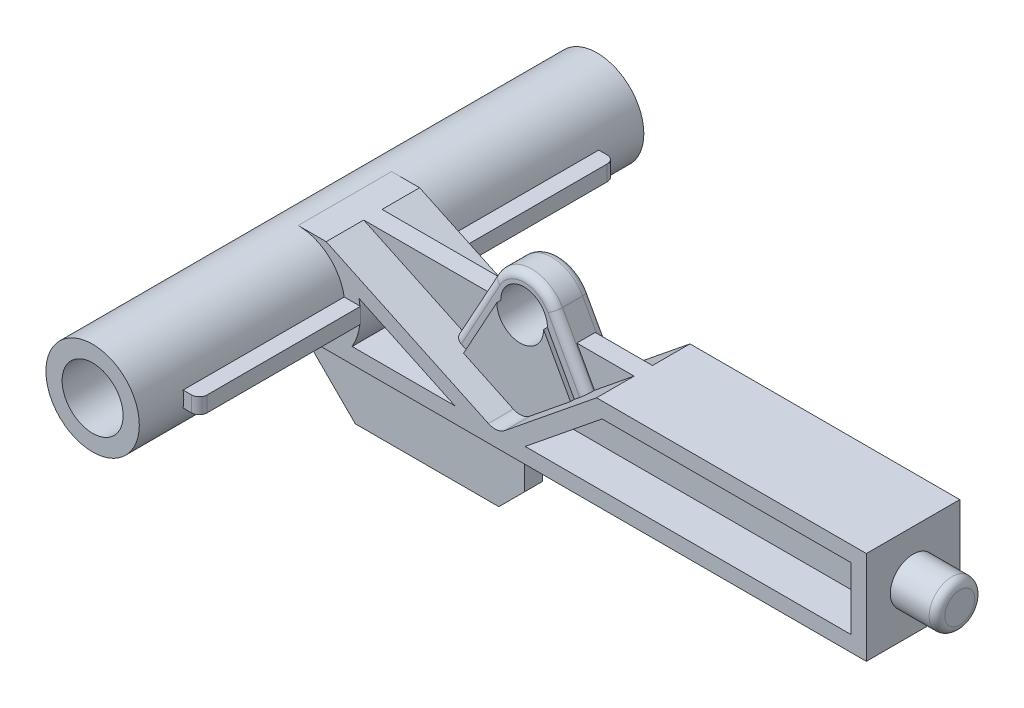
from build123d import *

# Parameters (mm, degrees)
BOSS_EXTRUDE3_DEPTH  = 3
SKETCH2_R            = 2.9999999999999982
BOSS_EXTRUDE4_DEPTH  = 16.205
SKETCH5_R            = 1.96
CUT_EXTRUDE2_DEPTH   = 32.80000000000002
SKETCH6_R            = 1.465
BOSS_EXTRUDE7_DEPTH  = 3
FILLET1_R            = 0.5
BOSS_EXTRUDE8_DEPTH  = 0.59
BOSS_EXTRUDE9_DEPTH  = 13.35
FILLET7_R            = 0.5
FILLET8_R            = 0.5
BOSS_EXTRUDE10_DEPTH = 3
CUT_EXTRUDE4_DEPTH   = 3
BOSS_EXTRUDE11_DEPTH = 0.59
BOSS_EXTRUDE12_DEPTH = 1.395
CUT_EXTRUDE6_DEPTH   = 20.895000000000014
CUT_EXTRUDE7_DEPTH   = 0.25
CUT_EXTRUDE8_DEPTH   = 0.25
FILLET9_R            = 0.5
FILLET10_R           = 0.5
CUT_EXTRUDE9_DEPTH   = 2.5
CUT_EXTRUDE10_DEPTH  = 2.5
CUT_EXTRUDE12_DEPTH  = 2.5
CUT_EXTRUDE14_START  = -2.5
CUT_EXTRUDE14_DEPTH  = 2.5


with BuildPart() as part:
    # Sketch1 → Boss-Extrude3 (new, symmetric)
    with BuildSketch(Plane.XY):
        with BuildLine():
            ThreePointArc((2.9999999999999982, 2.9999999999999973), (2.1213203435596406, 0.8786796564403563), (-5.5e-16, 0))
            Line((0, 0), (36.5, 0))
            Line((36.5, 0), (36.5, 6))
            Line((36.5, 6), (20.749999999999996, 5.999999999999999))
            ThreePointArc((20.749999999999996, 5.999999999999999), (20.435386233554034, 4.445031090493969), (19.54103584523481, 3.134669493650969))
            ThreePointArc((19.54103584523481, 3.1346694936509705), (17.593985916344508, 2.2872332130112563), (15.573673818645423, 2.9410609450836516))
            Line((15.573673818645423, 2.9410609450836516), (11.749999999999998, 5.9999999999999964))
            Line((11.749999999999998, 5.9999999999999964), (0, 5.9999999999999964))
            ThreePointArc((1.8e-16, 5.9999999999999964), (2.1213203435596415, 5.121320343559639), (2.9999999999999982, 2.9999999999999982))
        make_face()
    extrude(amount=BOSS_EXTRUDE3_DEPTH, both=True)

    # Sketch2 → Boss-Extrude4 (add, symmetric)
    with BuildSketch(Plane.XY):
        with Locations((0, 2.9999999999999982)):
            Circle(SKETCH2_R)
    extrude(amount=BOSS_EXTRUDE4_DEPTH, both=True)

    # Sketch5 → Cut-Extrude2 (cut)
    with BuildSketch(Plane.XY.offset(16.205)):
        with Locations((0, 2.9999999999999982)):
            Circle(SKETCH5_R)
    extrude(amount=-CUT_EXTRUDE2_DEPTH, mode=Mode.SUBTRACT)

    # Sketch6 → Boss-Extrude7 (add)
    with BuildSketch(Plane(origin=(36.5, 0, 0), x_dir=(0, 0, -1), z_dir=(1, 0, 0))):
        with Locations((0, 2.999999999999999)):
            Circle(SKETCH6_R)
    extrude(amount=BOSS_EXTRUDE7_DEPTH)

    # Fillet1
    fillet1_edges = [part.edges().sort_by_distance(p)[0] for p in [
        (39.5, 2.9999999999999987, 1.465),
    ]]
    fillet(fillet1_edges, radius=FILLET1_R)

    # Sketch12 → Boss-Extrude8 (add, symmetric)
    with BuildSketch(Plane.XY):
        with BuildLine():
            Line((12.12, -2.99e-15), (12.12, -3.970000000000003))
            Line((12.12, -3.970000000000003), (10.479512267647207, -5.6104877323527935))
            Line((10.479512267647207, -5.6104877323527935), (1.2595122676472073, -5.610487732352795))
            Line((1.2595122676472073, -5.610487732352795), (-2.8063517241754403, -1.5446237405301462))
            Line((-2.8063517241754403, -1.5446237405301462), (-2.8063517241754403, 1.939627423865778))
            ThreePointArc((-2.8063517241754403, 1.939627423865778), (-1.7057083970593148, 0.5320942351456543), (0, 0))
            Line((0, 0), (12.12, -2.99e-15))
        make_face()
    extrude(amount=BOSS_EXTRUDE8_DEPTH, both=True)

    # Sketch14 → Boss-Extrude9 (add, symmetric)
    with BuildSketch(Plane.XY):
        with BuildLine():
            Line((3.9999999999999982, 2.4999999999999982), (3.9999999999999982, 3.4999999999999982))
            Line((3.9999999999999982, 3.4999999999999982), (2.9580398915498067, 3.4999999999999982))
            ThreePointArc((2.9580398915498067, 3.4999999999999982), (2.999999999999999, 2.9999999999999982), (2.9580398915498067, 2.4999999999999982))
            Line((2.9580398915498067, 2.4999999999999982), (3.9999999999999982, 2.4999999999999982))
        make_face()
    extrude(amount=BOSS_EXTRUDE9_DEPTH, both=True)

    # Fillet7
    fillet7_edges = [part.edges().sort_by_distance(p)[0] for p in [
        (3.9999999999999982, 2.9999999999999982, 13.35),
    ]]
    fillet(fillet7_edges, radius=FILLET7_R)

    # Fillet8
    fillet8_edges = [part.edges().sort_by_distance(p)[0] for p in [
        (3.9999999999999982, 2.9999999999999982, -13.35),
    ]]
    fillet(fillet8_edges, radius=FILLET8_R)

    # Sketch15 → Boss-Extrude10 (add, symmetric)
    with BuildSketch(Plane.XY):
        Polygon((5.875, 5.9999999999999964), (27.07720850874597, 5.999999999999999), (27.07720850874597, 1.48970114733157), (5.875, 1.48970114733157), align=None)
    extrude(amount=BOSS_EXTRUDE10_DEPTH, both=True)

    # Sketch16 → Cut-Extrude4 (cut, symmetric)
    with BuildSketch(Plane.XY):
        with BuildLine():
            Line((19.169999999999998, 6.000000000000002), (1.8, 6))
            Line((1.8, 6), (12.214852275986694, 1.0953015306060347))
            ThreePointArc((12.214852275986694, 1.0953015306060354), (12.760871493283885, 1.00722209344764), (13.27019347571673, 1.2228284271177179))
            Line((13.27019347571673, 1.2228284271177183), (19.169999999999998, 6.000000000000002))
        make_face()
    extrude(amount=CUT_EXTRUDE4_DEPTH, both=True, mode=Mode.SUBTRACT)

    # Sketch17 → Boss-Extrude11 (add, symmetric)
    with BuildSketch(Plane.XY):
        Polygon((1.8, 6), (19.169999999999998, 5.999999999999999), (19.169999999999998, 0.49690997030879536), (1.8, 0.49690997030879536), (4.890483943976141, 2.396162656787146), align=None)
    extrude(amount=BOSS_EXTRUDE11_DEPTH, both=True)

    # Sketch19 → Boss-Extrude12 (add, symmetric)
    with BuildSketch(Plane.XY):
        with BuildLine():
            Line((8.17, 3.000156274700533), (10.684653005804094, 7.569117176028711))
            ThreePointArc((10.684653005804094, 7.569117176028711), (12.655773390851454, 8.734228825048191), (14.626946759842125, 7.569206818212221))
            Line((14.626946759842125, 7.569206818212221), (15.490695774172368, 5.999999999999999))
            Line((15.490695774172368, 5.999999999999999), (16.624997623308392, 3.9392692019970994))
            Line((16.624997623308392, 3.9392692019970994), (13.27019347571673, 1.2228284271177192))
            ThreePointArc((13.27019347571673, 1.2228284271177192), (12.760871493283883, 1.0072220934476446), (12.21485227598669, 1.0953015306060374))
            Line((12.21485227598669, 1.0953015306060374), (8.17, 3.000156274700533))
        make_face()
    extrude(amount=BOSS_EXTRUDE12_DEPTH, both=True)

    # Sketch20 → Cut-Extrude6 (cut, symmetric)
    with BuildSketch(Plane.XY.offset(1.395)):
        with BuildLine():
            ThreePointArc((14.155824552668768, 6.484228825629862), (12.655824552668768, 7.984228825629863), (11.155824552668768, 6.484228825629862))
            ThreePointArc((11.15582455266877, 6.484228825629865), (12.655824552668765, 4.984228825629861), (14.155824552668767, 6.484228825629859))
        make_face()
    extrude(amount=CUT_EXTRUDE6_DEPTH, both=True, mode=Mode.SUBTRACT)

    # Sketch21 → Cut-Extrude7 (cut, symmetric)
    with BuildSketch(Plane.XY.offset(1.395)):
        with BuildLine():
            Line((11.155824552668768, 6.484228825629862), (9.018377782257767, 2.60062711193924))
            Line((9.018377782257767, 2.60062711193924), (8.17, 3.000156274700535))
            Line((8.17, 3.000156274700535), (10.684653005804092, 7.569117176028711))
            ThreePointArc((10.684653005804092, 7.569117176028711), (12.655773390851452, 8.734228825048183), (14.626946759842125, 7.569206818212221))
            Line((14.626946759842125, 7.569206818212221), (16.62499762330839, 3.9392692019970985))
            Line((16.62499762330839, 3.9392692019970985), (15.886023032964967, 3.3409091724705715))
            Line((15.886023032964967, 3.3409091724705715), (14.155824552668767, 6.484228825629862))
            ThreePointArc((14.155824552668767, 6.484228825629862), (12.655824552668768, 4.984228825629862), (11.155824552668768, 6.484228825629862))
        make_face()
    extrude(amount=CUT_EXTRUDE7_DEPTH, both=True, mode=Mode.SUBTRACT)

    # Sketch22 → Cut-Extrude8 (cut, symmetric)
    with BuildSketch(Plane(origin=(0, 0, -1.395), x_dir=(-1, 0, 0), z_dir=(0, 0, -1))):
        with BuildLine():
            Line((-14.155824552668767, 6.484228825629862), (-15.886023032964967, 3.340909172470571))
            Line((-15.886023032964967, 3.340909172470571), (-16.624997623308392, 3.9392692019971034))
            Line((-16.624997623308392, 3.9392692019971034), (-14.626946759842125, 7.569206818212221))
            ThreePointArc((-14.626946759842125, 7.569206818212221), (-12.655773390851454, 8.73422882504819), (-10.684653005804092, 7.569117176028711))
            Line((-10.684653005804092, 7.569117176028711), (-8.17, 3.000156274700535))
            Line((-8.17, 3.000156274700535), (-9.018377782257769, 2.600627111939241))
            Line((-9.018377782257769, 2.600627111939241), (-11.155824552668768, 6.484228825629862))
            ThreePointArc((-11.155824552668768, 6.484228825629862), (-12.655824552668768, 4.984228825629864), (-14.155824552668767, 6.484228825629862))
        make_face()
    extrude(amount=CUT_EXTRUDE8_DEPTH, both=True, mode=Mode.SUBTRACT)

    # Fillet9
    fillet9_edges = [part.edges().sort_by_distance(p)[0] for p in [
        (9.427326502902046, 5.2846367253646225, -1.145),
        (15.625972191575258, 5.754238010104662, -1.145),
        (12.655773390851452, 8.73422882504819, -1.145),
    ]]
    fillet(fillet9_edges, radius=FILLET9_R)

    # Fillet10
    fillet10_edges = [part.edges().sort_by_distance(p)[0] for p in [
        (15.625972191575258, 5.754238010104659, 1.145),
        (9.427326502902046, 5.2846367253646225, 1.145),
        (12.655773390851452, 8.734228825048183, 1.145),
    ]]
    fillet(fillet10_edges, radius=FILLET10_R)

    # Sketch23 → Cut-Extrude9 (cut)
    with BuildSketch(Plane(origin=(0, 0, -3), x_dir=(-1, 0, 0), z_dir=(0, 0, -1))):
        Polygon((-35.5, 5), (-35.5, 1), (-14.230000308321648, 1), (-19.169999999999998, 5), align=None)
    extrude(amount=-CUT_EXTRUDE9_DEPTH, mode=Mode.SUBTRACT)

    # Sketch24 → Cut-Extrude10 (cut)
    with BuildSketch(Plane(origin=(0, 0, -3), x_dir=(-1, 0, 0), z_dir=(0, 0, -1))):
        with BuildLine():
            Line((-10.07009080824153, 1), (-3.4641016151377535, 1))
            ThreePointArc((-3.4641016151377535, 1), (-3.9566645904895195, 2.412798741174382), (-3.895636139676663, 3.9077549599121406))
            Line((-3.895636139676663, 3.9077549599121406), (-10.07009080824153, 1))
        make_face()
    extrude(amount=-CUT_EXTRUDE10_DEPTH, mode=Mode.SUBTRACT)

    # Sketch25 → Cut-Extrude12 (cut)
    with BuildSketch(Plane.XY.offset(3)):
        Polygon((19.524095671942906, 5), (35.5, 5), (35.5, 1), (14.584095980264548, 0.9999999999999983), align=None)
    extrude(amount=-CUT_EXTRUDE12_DEPTH, mode=Mode.SUBTRACT)

    # Sketch26 → Cut-Extrude14 (cut)
    with BuildSketch(Plane.XY.offset(3).offset(CUT_EXTRUDE14_START)):
        with BuildLine():
            Line((3.4641016151377535, 1), (10.070090808241538, 1))
            Line((10.070090808241538, 1), (3.8956361396766637, 3.9077549599121406))
            ThreePointArc((3.8956361396766637, 3.9077549599121406), (3.956664590489521, 2.4127987411743836), (3.4641016151377535, 1))
        make_face()
    extrude(amount=CUT_EXTRUDE14_DEPTH, mode=Mode.SUBTRACT)


solid = part.part
